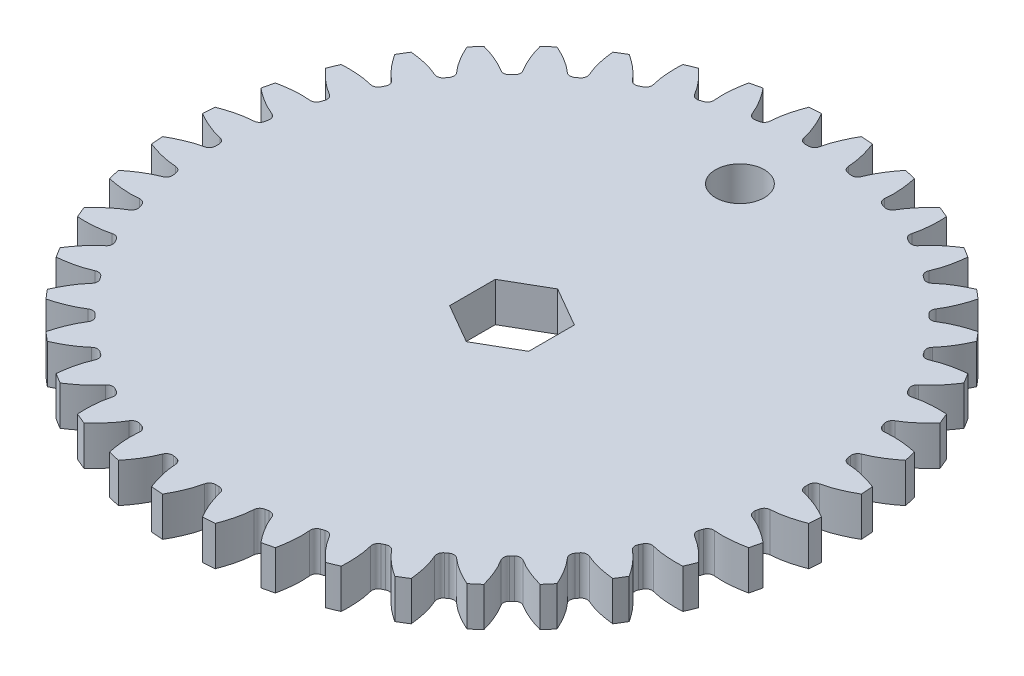
from build123d import *

# Parameters (mm, degrees)
SKETCH2_R                = 53.34
BOSS_EXTRUDE1_DEPTH      = 12.7
CUT_EXTRUDE1_DEPTH       = 12.7
FILLET2_R                = 1.016
CIRPATTERN1_COUNT        = 40
FILLET2_OF_CIRPATTERN1_R = 1.016
SKETCH4_R                = 4.09575
CUT_EXTRUDE2_DEPTH       = 77.359986682
CUT_EXTRUDE3_DEPTH       = 6.35
CUT_EXTRUDE4_DEPTH       = 77.359986682
CUT_EXTRUDE4_DEPTH_BACK  = 77.359986682
SKETCH6_R                = 3.937
SKETCH7_R                = 100.362348096
CUT_EXTRUDE5_DEPTH       = 76.56374835


with BuildPart() as part:
    # Sketch2 → Boss-Extrude1 (new body)
    with BuildSketch(Plane(origin=(0, 0, 0), x_dir=(1, 0, 0), z_dir=(0, 1, 0))):
        Circle(SKETCH2_R)
    extrude(amount=BOSS_EXTRUDE1_DEPTH)

    # Sketch3 → Cut-Extrude1 (cut)
    with BuildSketch(Plane(origin=(0, 0, 0), x_dir=(-1, 0, 0), z_dir=(0, -1, 0))):
        with BuildLine():
            Line((47.610863724, -1.16029328), (47.722215798, -1.163006969))
            add(Edge.make_bspline(
                [(47.722215798, -1.163006969), (47.730982789, -1.163313167), (47.755564012, -1.16445845), (47.802003051, -1.167754997), (47.87772523, -1.174741096), (47.974119041, -1.186004909), (48.098593622, -1.203276497), (48.245061479, -1.227112329), (48.405834144, -1.256963367), (48.580520514, -1.293386204), (48.754577285, -1.333212779), (48.927987969, -1.376189951), (49.100522746, -1.421931459), (49.30925176, -1.48080125), (49.559155717, -1.556203831), (49.850651678, -1.651349023), (50.180503564, -1.767531099), (50.515821541, -1.894787282), (50.845048793, -2.027276114), (51.176798745, -2.169495413), (51.497150175, -2.313020498), (51.828924093, -2.470658837), (52.134675109, -2.620519189), (52.476090794, -2.797888155), (52.751288045, -2.94379105), (53.034579939, -3.102405155), (53.172312998, -3.180768911), (53.242640535, -3.221308569)],
                knots=[0, 0, 0, 0, 0, 0.005376749, 0.015083688, 0.02853182, 0.04661014, 0.064854849, 0.092110526, 0.119476176, 0.146842496, 0.174208854, 0.201574956, 0.228941013, 0.256307345, 0.307035032, 0.361767352, 0.416499661, 0.471231937, 0.525964282, 0.580696616, 0.635428982, 0.690161387, 0.744893688, 0.799626082, 0.854358407, 0.909090914, 0.909090914, 0.909090914, 0.909090914, 0.909090914], degree=4))
            ThreePointArc((53.242640535, -3.221308569), (53.34, 0), (53.242640535, 3.221308569))
            add(Edge.make_bspline(
                [(53.242640535, 3.221308569), (53.172312998, 3.180768911), (53.034579939, 3.102405155), (52.751288045, 2.94379105), (52.476090794, 2.797888155), (52.134675109, 2.620519189), (51.828924093, 2.470658837), (51.497150175, 2.313020498), (51.176798745, 2.169495413), (50.845048793, 2.027276114), (50.515821541, 1.894787282), (50.180503564, 1.767531099), (49.850651678, 1.651349023), (49.559155717, 1.556203831), (49.30925176, 1.48080125), (49.100522746, 1.421931459), (48.927987969, 1.376189951), (48.754577285, 1.333212779), (48.580520514, 1.293386204), (48.405834144, 1.256963367), (48.245061479, 1.227112329), (48.098593622, 1.203276497), (47.974119041, 1.186004909), (47.87772523, 1.174741096), (47.80200305, 1.167754997), (47.755564012, 1.16445845), (47.730982789, 1.163313167), (47.722215798, 1.163006969)],
                knots=[0.484570751, 0.484570751, 0.484570751, 0.484570751, 0.484570751, 0.539303258, 0.594035583, 0.648767977, 0.703500278, 0.758232683, 0.81296505, 0.867697383, 0.922429728, 0.977162004, 1.031894313, 1.086626633, 1.13735432, 1.164720652, 1.19208671, 1.219452811, 1.246819169, 1.274185489, 1.30155114, 1.328806816, 1.347051526, 1.365129845, 1.378577977, 1.388284917, 1.393661665, 1.393661665, 1.393661665, 1.393661665, 1.393661665], degree=4))
            Line((47.722215798, 1.163006969), (47.610863724, 1.16029328))
            ThreePointArc((47.610863724, 1.16029328), (47.625, 0), (47.610863724, -1.16029328))
        make_face()
    cut_extrude1 = extrude(amount=-CUT_EXTRUDE1_DEPTH, mode=Mode.SUBTRACT)

    # Fillet2
    fillet2_edges = [part.edges().sort_by_distance(p)[0] for p in [
        (-47.610863724, 6.35, -1.16029328),
        (-47.610863724, 6.35, 1.16029328),
    ]]
    fillet(fillet2_edges, radius=FILLET2_R)

    # CirPattern1: Cut-Extrude1 ×40 about axis
    cirpattern1_axis = Axis((0, 12.7, 0), (0, 1, 0))
    for i in range(1, CIRPATTERN1_COUNT):
        add(cut_extrude1.rotate(cirpattern1_axis, i * 360 / CIRPATTERN1_COUNT), mode=Mode.SUBTRACT)

    # Fillet2 of CirPattern1
    fillet2_of_cirpattern1_edges = [part.edges().sort_by_distance(p)[0] for p in [
        (-47.206204844, 6.35, 6.301971852),
        (-46.843185127, 6.35, 8.593988141),
        (-45.639172533, 6.35, 13.609061523),
        (-44.922071849, 6.35, 15.816070492),
        (-42.948352326, 6.35, 20.581050932),
        (-41.894828074, 6.35, 22.648708697),
        (-39.200001148, 6.35, 27.046266564),
        (-37.835994591, 6.35, 28.923660528),
        (-34.486415844, 6.35, 32.845513351),
        (-32.845513351, 6.35, 34.486415844),
        (-28.923660528, 6.35, 37.835994591),
        (-27.046266564, 6.35, 39.200001148),
        (-22.648708697, 6.35, 41.894828074),
        (-20.581050932, 6.35, 42.948352326),
        (-15.816070492, 6.35, 44.922071849),
        (-13.609061523, 6.35, 45.639172533),
        (-8.593988141, 6.35, 46.843185127),
        (-6.301971852, 6.35, 47.206204844),
        (-1.16029328, 6.35, 47.610863724),
        (1.16029328, 6.35, 47.610863724),
        (6.301971852, 6.35, 47.206204844),
        (8.593988141, 6.35, 46.843185127),
        (13.609061523, 6.35, 45.639172533),
        (15.816070492, 6.35, 44.922071849),
        (20.581050932, 6.35, 42.948352326),
        (22.648708697, 6.35, 41.894828074),
        (27.046266564, 6.35, 39.200001148),
        (28.923660528, 6.35, 37.835994591),
        (32.845513351, 6.35, 34.486415844),
        (34.486415844, 6.35, 32.845513351),
        (37.835994591, 6.35, 28.923660528),
        (39.200001148, 6.35, 27.046266564),
        (41.894828074, 6.35, 22.648708697),
        (42.948352326, 6.35, 20.581050932),
        (44.922071849, 6.35, 15.816070492),
        (45.639172533, 6.35, 13.609061523),
        (46.843185127, 6.35, 8.593988141),
        (47.206204844, 6.35, 6.301971852),
        (47.610863724, 6.35, 1.16029328),
        (47.610863724, 6.35, -1.16029328),
        (47.206204844, 6.35, -6.301971852),
        (46.843185127, 6.35, -8.593988141),
        (45.639172533, 6.35, -13.609061523),
        (44.922071849, 6.35, -15.816070492),
        (42.948352326, 6.35, -20.581050932),
        (41.894828074, 6.35, -22.648708697),
        (39.200001148, 6.35, -27.046266564),
        (37.835994591, 6.35, -28.923660528),
        (34.486415844, 6.35, -32.845513351),
        (32.845513351, 6.35, -34.486415844),
        (28.923660528, 6.35, -37.835994591),
        (27.046266564, 6.35, -39.200001148),
        (22.648708697, 6.35, -41.894828074),
        (20.581050932, 6.35, -42.948352326),
        (15.816070492, 6.35, -44.922071849),
        (13.609061523, 6.35, -45.639172533),
        (8.593988141, 6.35, -46.843185127),
        (6.301971852, 6.35, -47.206204844),
        (1.16029328, 6.35, -47.610863724),
        (-1.16029328, 6.35, -47.610863724),
        (-6.301971852, 6.35, -47.206204844),
        (-8.593988141, 6.35, -46.843185127),
        (-13.609061523, 6.35, -45.639172533),
        (-15.816070492, 6.35, -44.922071849),
        (-20.581050932, 6.35, -42.948352326),
        (-22.648708697, 6.35, -41.894828074),
        (-27.046266564, 6.35, -39.200001148),
        (-28.923660528, 6.35, -37.835994591),
        (-32.845513351, 6.35, -34.486415844),
        (-34.486415844, 6.35, -32.845513351),
        (-37.835994591, 6.35, -28.923660528),
        (-39.200001148, 6.35, -27.046266564),
        (-41.894828074, 6.35, -22.648708697),
        (-42.948352326, 6.35, -20.581050932),
        (-44.922071849, 6.35, -15.816070492),
        (-45.639172533, 6.35, -13.609061523),
        (-46.843185127, 6.35, -8.593988141),
        (-47.206204844, 6.35, -6.301971852),
    ]]
    fillet(fillet2_of_cirpattern1_edges, radius=FILLET2_OF_CIRPATTERN1_R)

    # Sketch4 → Cut-Extrude2 (cut, through all)
    with BuildSketch(Plane(origin=(0, 12.7, 0), x_dir=(1, 0, 0), z_dir=(0, 1, 0))):
        Circle(SKETCH4_R)
    extrude(amount=-CUT_EXTRUDE2_DEPTH, mode=Mode.SUBTRACT)

    # Sketch5 → Cut-Extrude3 (cut)
    with BuildSketch(Plane(origin=(0, 12.7, 0), x_dir=(1, 0, 0), z_dir=(0, 1, 0))):
        Polygon((0, 7.376342509), (-6.3881, 3.688171255), (-6.3881, -3.688171255), (0, -7.376342509), (6.3881, -3.688171255), (6.3881, 3.688171255), align=None)
    extrude(amount=-CUT_EXTRUDE3_DEPTH, mode=Mode.SUBTRACT)

    # Sketch6 → Cut-Extrude4 (cut, two sides: drawn at the far end of the back side and taken through both)
    with BuildSketch(Plane(origin=(0, 12.7, 0), x_dir=(1, 0, 0), z_dir=(0, 1, 0)).offset(-CUT_EXTRUDE4_DEPTH_BACK)):
        with Locations((0, 36.83)):
            Circle(SKETCH6_R)
    extrude(amount=CUT_EXTRUDE4_DEPTH + CUT_EXTRUDE4_DEPTH_BACK, mode=Mode.SUBTRACT)

    # Sketch7 → Cut-Extrude5 (cut, through all)
    with BuildSketch(Plane(origin=(0, 6.35, 0), x_dir=(1, 0, 0), z_dir=(0, 1, 0))):
        Circle(SKETCH7_R)
    extrude(amount=-CUT_EXTRUDE5_DEPTH, mode=Mode.SUBTRACT)


solid = part.part
